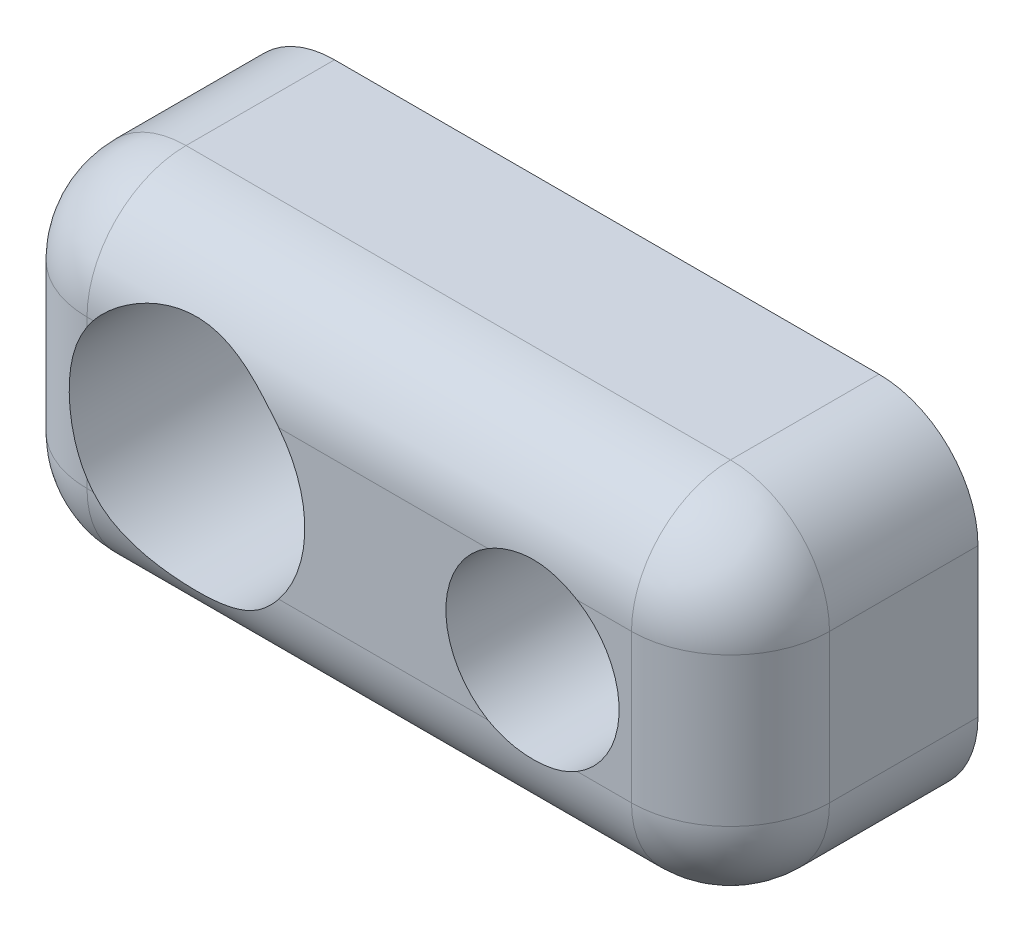
from build123d import *

# Parameters (mm, degrees)
SKETCH1_R           = 2.399999999999999
SKETCH1_R_2         = 1.75
BOSS_EXTRUDE1_DEPTH = 5
FILLET1_R           = 2


with BuildPart() as part:
    # Sketch1 → Boss-Extrude1 (new body)
    with BuildSketch(Plane.XY):
        with BuildLine():
            Line((-5.500000000000002, 3.5), (5.499999999999998, 3.5))
            ThreePointArc((5.499999999999998, 3.5), (6.914213562373094, 2.914213562373095), (7.499999999999998, 1.4999999999999998))
            Line((7.499999999999998, 1.4999999999999998), (7.499999999999998, -1.5000000000000002))
            ThreePointArc((7.499999999999998, -1.5000000000000002), (6.914213562373094, -2.914213562373096), (5.499999999999998, -3.500000000000001))
            Line((5.499999999999998, -3.500000000000001), (-5.500000000000002, -3.500000000000001))
            ThreePointArc((-5.500000000000002, -3.500000000000001), (-6.914213562373097, -2.914213562373096), (-7.500000000000002, -1.5000000000000007))
            Line((-7.500000000000002, -1.5000000000000007), (-7.500000000000002, 1.4999999999999993))
            ThreePointArc((-7.500000000000002, 1.4999999999999993), (-6.914213562373097, 2.914213562373095), (-5.500000000000002, 3.5))
        make_face()
        with Locations((-3.5000000000000013, 0)):
            Circle(SKETCH1_R, mode=Mode.SUBTRACT)
        with Locations((3.5000000000000013, 1.29e-15)):
            Circle(SKETCH1_R_2, mode=Mode.SUBTRACT)
    extrude(amount=BOSS_EXTRUDE1_DEPTH)

    # Fillet1
    # the kernel refuses this fillet: 2 mm, written as the material it takes off along each edge
    with BuildSketch(Plane(origin=(-5.500000000000001, 1.4999999999999987, 5), x_dir=(-1, 3.3e-16, 0), z_dir=(-3.3e-16, -1, 0))) as fillet1_piece_1:
        with BuildLine():
            CenterArc((2.000000000000001 - FILLET1_R, FILLET1_R), FILLET1_R, 270, 90)
            Line((2.000000000000001 - FILLET1_R, 0), (2.000000000000001, 0))
            Line((2.000000000000001, 0), (2.000000000000001, FILLET1_R))
        make_face()
    revolve(axis=Axis((-5.500000000000001, 1.4999999999999987, 5), (0, 0, -1)), revolution_arc=89.99999999999996, mode=Mode.SUBTRACT)
    with BuildSketch(Plane(origin=(-7.500000000000002, -1.5000000000000007, 5), x_dir=(0, 0, -1), z_dir=(0, 1, 0)), Plane(origin=(7.499999999999998, 1.4999999999999998, 5), x_dir=(0, 0, -1), z_dir=(0, -1, 0))) as fillet1_piece_2:
        with BuildLine():
            CenterArc((FILLET1_R, -FILLET1_R), FILLET1_R, 90, 90)
            Line((0, -FILLET1_R), (0, 0))
            Line((0, 0), (FILLET1_R, 0))
        make_face()
    extrude(amount=3, mode=Mode.SUBTRACT)
    with BuildSketch(Plane(origin=(-5.500000000000002, -1.5000000000000002, 5), x_dir=(0, -1, 0), z_dir=(1, 0, 0))) as fillet1_piece_3:
        with BuildLine():
            CenterArc((2.000000000000001 - FILLET1_R, FILLET1_R), FILLET1_R, 270, 90)
            Line((2.000000000000001 - FILLET1_R, 0), (2.000000000000001, 0))
            Line((2.000000000000001, 0), (2.000000000000001, FILLET1_R))
        make_face()
    revolve(axis=Axis((-5.500000000000002, -1.5000000000000002, 5), (0, 0, -1)), revolution_arc=89.99999999999999, mode=Mode.SUBTRACT)
    with BuildSketch(Plane(origin=(5.499999999999998, -3.500000000000001, 5), x_dir=(0, 0, -1), z_dir=(-1, 0, 0)), Plane(origin=(-5.500000000000002, 3.5, 5), x_dir=(0, 0, -1), z_dir=(1, 0, 0))) as fillet1_piece_4:
        with BuildLine():
            CenterArc((FILLET1_R, -FILLET1_R), FILLET1_R, 90, 90)
            Line((0, -FILLET1_R), (0, 0))
            Line((0, 0), (FILLET1_R, 0))
        make_face()
    extrude(amount=11, mode=Mode.SUBTRACT)
    with BuildSketch(Plane(origin=(5.499999999999999, -1.5000000000000018, 5), x_dir=(1, 7.8e-16, 0), z_dir=(-7.8e-16, 1, 0))) as fillet1_piece_5:
        with BuildLine():
            CenterArc((1.9999999999999991 - FILLET1_R, FILLET1_R), FILLET1_R, 270, 90)
            Line((1.9999999999999991 - FILLET1_R, 0), (1.9999999999999991, 0))
            Line((1.9999999999999991, 0), (1.9999999999999991, FILLET1_R))
        make_face()
    revolve(axis=Axis((5.499999999999999, -1.5000000000000018, 5), (0, 0, -1)), revolution_arc=90.00000000000007, mode=Mode.SUBTRACT)
    with BuildSketch(Plane(origin=(5.499999999999999, 1.5000000000000013, 5), x_dir=(-4.4e-16, 1, 0), z_dir=(-1, -4.4e-16, 0))) as fillet1_piece_6:
        with BuildLine():
            CenterArc((1.9999999999999987 - FILLET1_R, FILLET1_R), FILLET1_R, 270, 90)
            Line((1.9999999999999987 - FILLET1_R, 0), (1.9999999999999987, 0))
            Line((1.9999999999999987, 0), (1.9999999999999987, FILLET1_R))
        make_face()
    revolve(axis=Axis((5.499999999999999, 1.5000000000000013, 5), (0, 0, -1)), revolution_arc=90.00000000000007, mode=Mode.SUBTRACT)


solid = part.part
